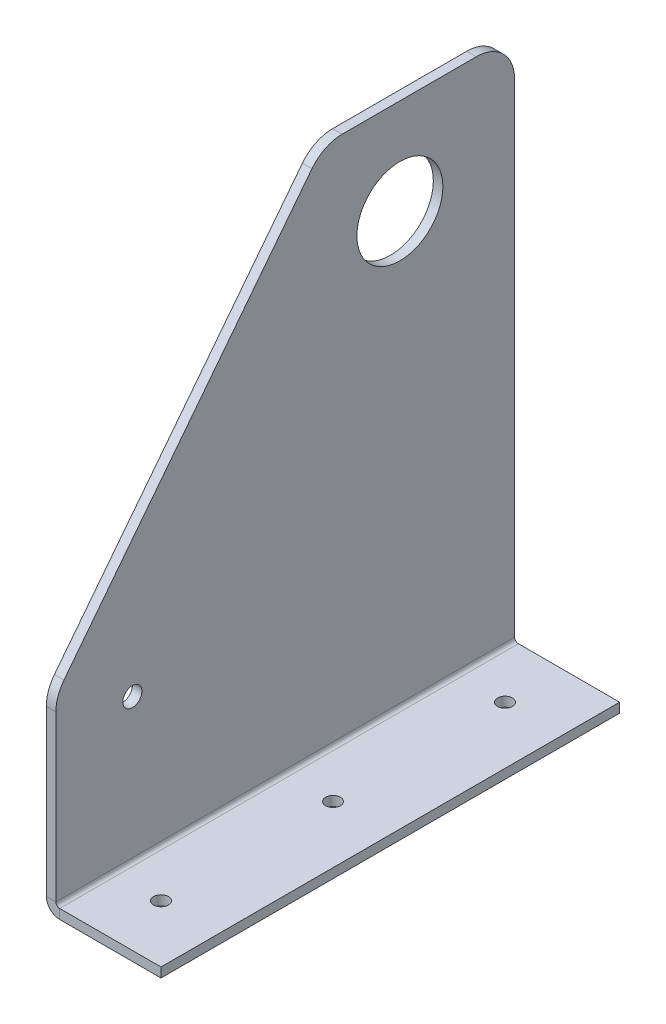
from build123d import *

# Parameters (mm, degrees)
SKETCH1_R              = 14.2875
BOSS_EXTRUDE1_DEPTH    = 3.175
SKETCH2_W              = 38.1
SKETCH2_H              = 3.175
BOSS_EXTRUDE2_DEPTH    = 152.4
SKETCH3_R              = 2.45745
CUT_EXTRUDE1_DEPTH     = 195.298586266
CONVERT_SOLID1_START   = -76.2
CONVERT_SOLID1_DEPTH   = 152.4
CONVERT_SOLID1_2_DEPTH = 152.4
SKETCH4_R              = 3.175
CUT_EXTRUDE3_DEPTH     = 198.157018643


# Read off the part's stored shape, not the designer's step: Convert-Solid1
with BuildPart() as part:
    # Sketch1 → Boss-Extrude1 (new body)
    with BuildSketch(Plane(origin=(0, 0, 0), x_dir=(0, 0, -1), z_dir=(1, 0, 0))):
        with BuildLine():
            Line((-76.2, 0), (-76.2, 59.142531573))
            ThreePointArc((-76.2, 59.142531573), (-75.512589628, 63.264144174), (-73.524773161, 66.939577365))
            Line((-73.524773161, 66.939577365), (8.886591171, 172.897045792))
            ThreePointArc((8.886591171, 172.897045792), (13.331600966, 176.508603805), (18.911364332, 177.8))
            Line((18.911364332, 177.8), (63.5, 177.8))
            ThreePointArc((63.5, 177.8), (72.480256121, 174.080256121), (76.2, 165.1))
            Line((76.2, 165.1), (76.2, 0))
            Line((76.2, 0), (-76.2, 0))
        make_face()
        with Locations((38.1, 146.05)):
            Circle(SKETCH1_R, mode=Mode.SUBTRACT)
    extrude(amount=BOSS_EXTRUDE1_DEPTH)

    # Sketch2 → Boss-Extrude2 (add)
    with BuildSketch(Plane.XY.offset(76.2)):
        with Locations((19.05, 1.5875)):
            Rectangle(SKETCH2_W, SKETCH2_H)
    extrude(amount=-BOSS_EXTRUDE2_DEPTH)

    # Sketch3 → Cut-Extrude1 (cut, through all)
    with BuildSketch(Plane(origin=(0, 3.175, 0), x_dir=(1, 0, 0), z_dir=(0, 1, 0))):
        with Locations(Location((19.05, 57.15, 0), (0, 0, 270))):
            Circle(SKETCH3_R)
        with Locations(Location((19.05, 0, 0), (0, 0, 270))):
            Circle(SKETCH3_R)
        with Locations(Location((19.05, -57.15, 0), (0, 0, 270))):
            Circle(SKETCH3_R)
    extrude(amount=-CUT_EXTRUDE1_DEPTH, mode=Mode.SUBTRACT)

    # Convert-Solid1 outline → Convert-Solid1 (cut)
    with BuildSketch(Plane.XY.offset(CONVERT_SOLID1_START)):
        with BuildLine():
            Line((0, 0), (4.445, 0))
            ThreePointArc((4.445, 0), (1.301910358, 1.301910358), (0, 4.445))
            Line((0, 4.445), (0, 0))
        make_face()
    extrude(amount=CONVERT_SOLID1_DEPTH, mode=Mode.SUBTRACT)

    # Convert-Solid1 2 outline → Convert-Solid1 2 (add)
    with BuildSketch(Plane.XY.offset(CONVERT_SOLID1_START)):
        with BuildLine():
            Line((3.175, 3.175), (4.445, 3.175))
            ThreePointArc((4.445, 3.175), (3.546974388, 3.546974388), (3.175, 4.445))
            Line((3.175, 4.445), (3.175, 3.175))
        make_face()
    extrude(amount=CONVERT_SOLID1_2_DEPTH)

    # Sketch4 → Cut-Extrude3 (cut, through all)
    with BuildSketch(Plane.ZY):
        with Locations((50.8, 50.8)):
            Circle(SKETCH4_R)
    extrude(amount=-CUT_EXTRUDE3_DEPTH, mode=Mode.SUBTRACT)


solid = part.part
